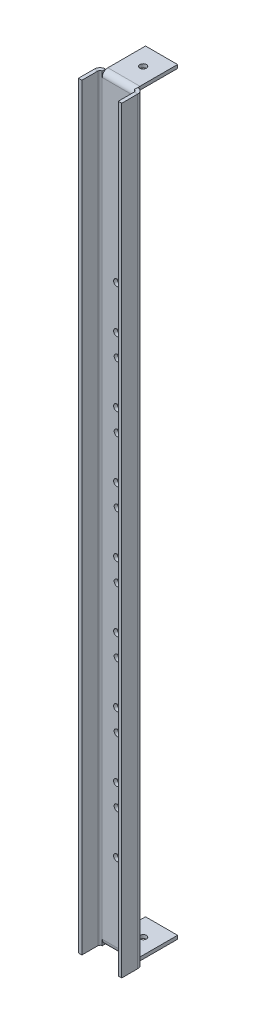
from build123d import *

# Parameters (mm, degrees)
SKETCH1_W                      = 40
SKETCH1_H                      = 700
BASE_FLANGE1_DEPTH             = 3.2
EDGE_FLANGE1_STRIP_W           = 16.8
EDGE_FLANGE1_STRIP_H           = 3.2
EDGE_FLANGE1_STRIP_CUT_DEPTH   = 700
EDGE_FLANGE1_STRIP_2_W         = 16.8
EDGE_FLANGE1_STRIP_2_H         = 3.2
EDGE_FLANGE1_STRIP_CUT_2_DEPTH = 700
EDGE_FLANGE1_DEPTH             = 700
EDGE_FLANGE1_BEND_DEPTH        = 700
EDGE_FLANGE2_STRIP_W           = 16.8
EDGE_FLANGE2_STRIP_H           = 3.2
EDGE_FLANGE2_STRIP_CUT_DEPTH   = 29.6
EDGE_FLANGE2_STRIP_2_W         = 16.8
EDGE_FLANGE2_STRIP_2_H         = 3.2
EDGE_FLANGE2_STRIP_CUT_2_DEPTH = 29.6
EDGE_FLANGE2_DEPTH             = 29.6
EDGE_FLANGE2_BEND_DEPTH        = 29.6
SKETCH18_R                     = 3
CUT_EXTRUDE1_DEPTH             = 702.43940692
SKETCH29_R                     = 3
CUT_EXTRUDE12_DEPTH            = 15
CUT_EXTRUDE13_START            = -5.9
CUT_EXTRUDE13_OUTLINE_R        = 3
CUT_EXTRUDE13_DEPTH            = 3.2


# Read off the part's stored shape, not the designer's step: Cut-Extrude13
# Sheet-metal steps are written as plain solids
with BuildPart() as part:
    # Sketch1 → Base-Flange1 (new body)
    with BuildSketch(Plane.XY):
        with Locations((-0.426492134, -287.746478873)):
            Rectangle(SKETCH1_W, SKETCH1_H)
    extrude(amount=-BASE_FLANGE1_DEPTH)

    # Edge-Flange1 strip (across the edge) → Edge-Flange1 strip cut (cut)
    with BuildSketch(Plane(origin=(-20.426492134, 62.253521127, 0), x_dir=(1, 0, 0), z_dir=(0, -1, 0))):
        with Locations((-3.2, -1.6)):
            Rectangle(EDGE_FLANGE1_STRIP_W, EDGE_FLANGE1_STRIP_H)
    extrude(amount=EDGE_FLANGE1_STRIP_CUT_DEPTH, mode=Mode.SUBTRACT)

    # Edge-Flange1 strip 2 (across the edge) → Edge-Flange1 strip cut 2 (cut)
    with BuildSketch(Plane(origin=(19.573507866, -637.746478873, 0), x_dir=(-1, 0, 0), z_dir=(0, 1, 0))):
        with Locations((-3.2, -1.6)):
            Rectangle(EDGE_FLANGE1_STRIP_2_W, EDGE_FLANGE1_STRIP_2_H)
    extrude(amount=EDGE_FLANGE1_STRIP_CUT_2_DEPTH, mode=Mode.SUBTRACT)

    # Edge-Flange1 section (across the edge) → Edge-Flange1 (add)
    with BuildSketch(Plane(origin=(-20.426492134, 62.253521127, 0), x_dir=(1, 0, 0), z_dir=(0, -1, 0))):
        with BuildLine():
            Line((0, 2), (0, 16.8))
            Line((0, 16.8), (3.2, 16.8))
            Line((3.2, 16.8), (3.2, 2))
            ThreePointArc((3.2, 2), (3.785786438, 0.585786438), (5.2, 0))
            Line((5.2, 0), (5.2, -3.2))
            ThreePointArc((5.2, -3.2), (1.523044738, -1.676955262), (0, 2))
        make_face()
    extrude(amount=EDGE_FLANGE1_DEPTH)

    # Edge-Flange1 section 2 (across the edge) → Edge-Flange1 bend (add)
    with BuildSketch(Plane(origin=(19.573507866, -637.746478873, 0), x_dir=(-1, 0, 0), z_dir=(0, 1, 0))):
        with BuildLine():
            Line((0, 2), (0, 16.8))
            Line((0, 16.8), (3.2, 16.8))
            Line((3.2, 16.8), (3.2, 2))
            ThreePointArc((3.2, 2), (3.785786438, 0.585786438), (5.2, 0))
            Line((5.2, 0), (5.2, -3.2))
            ThreePointArc((5.2, -3.2), (1.523044738, -1.676955262), (0, 2))
        make_face()
    extrude(amount=EDGE_FLANGE1_BEND_DEPTH)

    # Edge-Flange2 strip (across the edge) → Edge-Flange2 strip cut (cut)
    with BuildSketch(Plane(origin=(-15.226492134, 62.253521127, -3.2), x_dir=(0, -1, 0), z_dir=(1, 0, 0))):
        with Locations((-3.2, -1.6)):
            Rectangle(EDGE_FLANGE2_STRIP_W, EDGE_FLANGE2_STRIP_H)
    extrude(amount=EDGE_FLANGE2_STRIP_CUT_DEPTH, mode=Mode.SUBTRACT)

    # Edge-Flange2 strip 2 (across the edge) → Edge-Flange2 strip cut 2 (cut)
    with BuildSketch(Plane(origin=(14.373507866, -637.746478873, -3.2), x_dir=(0, 1, 0), z_dir=(-1, 0, 0))):
        with Locations((-3.2, -1.6)):
            Rectangle(EDGE_FLANGE2_STRIP_2_W, EDGE_FLANGE2_STRIP_2_H)
    extrude(amount=EDGE_FLANGE2_STRIP_CUT_2_DEPTH, mode=Mode.SUBTRACT)

    # Edge-Flange2 section (across the edge) → Edge-Flange2 (add)
    with BuildSketch(Plane(origin=(-15.226492134, 62.253521127, -3.2), x_dir=(0, -1, 0), z_dir=(1, 0, 0))):
        with BuildLine():
            Line((0, 2), (0, 36.8))
            Line((0, 36.8), (3.2, 36.8))
            Line((3.2, 36.8), (3.2, 2))
            ThreePointArc((3.2, 2), (3.785786438, 0.585786438), (5.2, 0))
            Line((5.2, 0), (5.2, -3.2))
            ThreePointArc((5.2, -3.2), (1.523044738, -1.676955262), (0, 2))
        make_face()
    extrude(amount=EDGE_FLANGE2_DEPTH)

    # Edge-Flange2 section 2 (across the edge) → Edge-Flange2 bend (add)
    with BuildSketch(Plane(origin=(14.373507866, -637.746478873, -3.2), x_dir=(0, 1, 0), z_dir=(-1, 0, 0))):
        with BuildLine():
            Line((0, 2), (0, 36.8))
            Line((0, 36.8), (3.2, 36.8))
            Line((3.2, 36.8), (3.2, 2))
            ThreePointArc((3.2, 2), (3.785786438, 0.585786438), (5.2, 0))
            Line((5.2, 0), (5.2, -3.2))
            ThreePointArc((5.2, -3.2), (1.523044738, -1.676955262), (0, 2))
        make_face()
    extrude(amount=EDGE_FLANGE2_BEND_DEPTH)

    # Sketch18 → Cut-Extrude1 (cut, through all)
    with BuildSketch(Plane(origin=(0, 62.253521127, 0), x_dir=(1, 0, 0), z_dir=(0, 1, 0))):
        with Locations(Location((0, 22.6, 0), (0, 0, 270))):
            Circle(SKETCH18_R)
    extrude(amount=-CUT_EXTRUDE1_DEPTH, mode=Mode.SUBTRACT)

    # Sketch29 → Cut-Extrude12 (cut)
    with BuildSketch(Plane(origin=(98.729905779, -312.144507489, -5.9), x_dir=(-1, 0, 0), z_dir=(0, 0, -1))):
        with Locations((100.456397914, 211.698028616)):
            Circle(SKETCH29_R)
        with Locations((100.456397914, 171.698028616)):
            Circle(SKETCH29_R)
        with Locations((100.456397914, 111.698028616)):
            Circle(SKETCH29_R)
        with Locations((100.456397914, 51.698028616)):
            Circle(SKETCH29_R)
        with Locations((100.456397914, -8.301971384)):
            Circle(SKETCH29_R)
        with Locations((100.456397914, -68.301971384)):
            Circle(SKETCH29_R)
        with Locations((100.456397914, -128.301971384)):
            Circle(SKETCH29_R)
        with Locations((100.456397914, -188.301971384)):
            Circle(SKETCH29_R)
        with Locations((100.456397914, -248.301971384)):
            Circle(SKETCH29_R)
    extrude(amount=-CUT_EXTRUDE12_DEPTH, mode=Mode.SUBTRACT)

    # Cut-Extrude13 outline → Cut-Extrude13 (cut)
    with BuildSketch(Plane(origin=(260.729905779, -312.144507489, -5.9), x_dir=(-1, 0, 0), z_dir=(0, 0, -1)).offset(CUT_EXTRUDE13_START)):
        with BuildLine():
            ThreePointArc((262.206397914, -251.29153657), (259.456397914, -248.301971384), (262.206397914, -245.312406198))
            ThreePointArc((262.206397914, -245.312406198), (258.956397914, -248.301971384), (262.206397914, -251.29153657))
        make_face()
        with BuildLine():
            ThreePointArc((262.206397914, 208.70846343), (259.456397914, 211.698028616), (262.206397914, 214.687593802))
            ThreePointArc((262.206397914, 214.687593802), (258.956397914, 211.698028616), (262.206397914, 208.70846343))
        make_face()
        with Locations((261.956397914, -208.301971384)):
            Circle(CUT_EXTRUDE13_OUTLINE_R)
        with Locations((261.956397914, -148.301971384)):
            Circle(CUT_EXTRUDE13_OUTLINE_R)
        with Locations((261.956397914, -88.301971384)):
            Circle(CUT_EXTRUDE13_OUTLINE_R)
        with Locations((261.956397914, -28.301971384)):
            Circle(CUT_EXTRUDE13_OUTLINE_R)
        with Locations((261.956397914, 31.698028616)):
            Circle(CUT_EXTRUDE13_OUTLINE_R)
        with Locations((261.956397914, 91.698028616)):
            Circle(CUT_EXTRUDE13_OUTLINE_R)
        with Locations((261.956397914, 151.698028616)):
            Circle(CUT_EXTRUDE13_OUTLINE_R)
    extrude(amount=CUT_EXTRUDE13_DEPTH, mode=Mode.SUBTRACT)


solid = part.part
